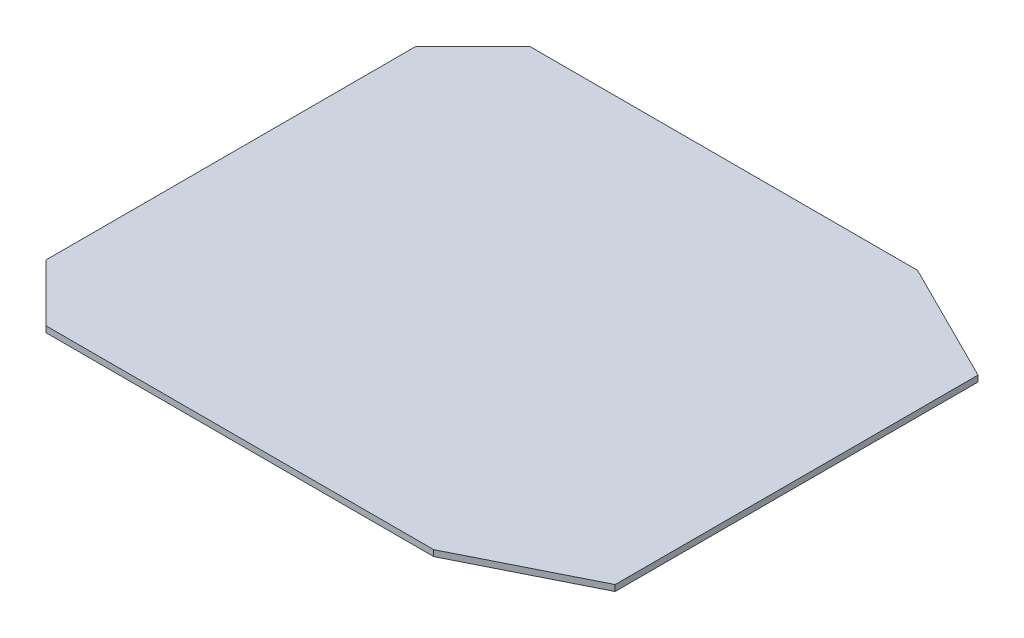
from build123d import *

# Parameters (mm, degrees)
BOSS_EXTRUDE1_DEPTH = 3


with BuildPart() as part:
    # Sketch2 → Boss-Extrude1 (new body)
    with BuildSketch(Plane(origin=(0, 0, 0), x_dir=(1, 0, 0), z_dir=(0, 1, 0))):
        Polygon((-392.490974729, 6.74904791), (-364.206703482, -21.535223337), (-171.860133085, -21.535223337), (-111.860133085, 8.464776663), (-111.860133085, 188.464776663), (-171.860133085, 218.464776663), (-364.206703482, 218.464776663), (-392.490974729, 190.180505415), align=None)
    extrude(amount=BOSS_EXTRUDE1_DEPTH)


solid = part.part
